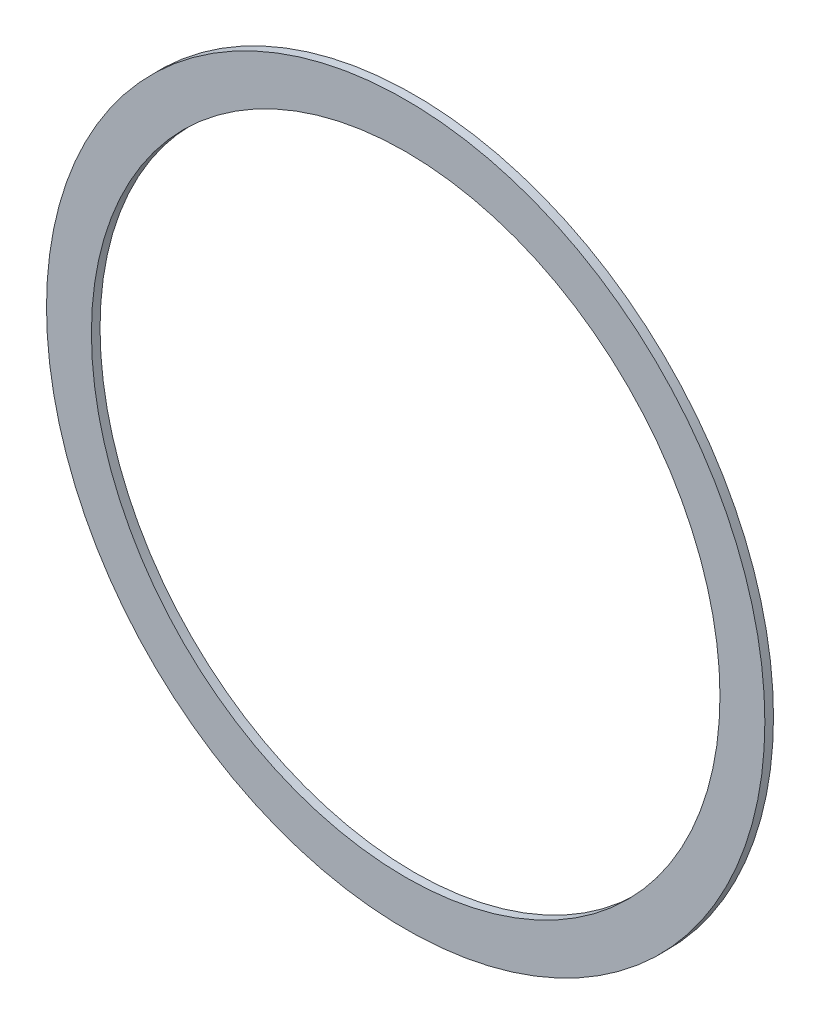
from build123d import *

# Parameters (mm, degrees)
SKETCH2_R           = 115.57
BOSS_EXTRUDE1_DEPTH = 1.5875


with BuildPart() as part:
    # Sketch2 → Boss-Extrude1 (new, symmetric)
    with BuildSketch(Plane.XY):
        with BuildLine():
            ThreePointArc((-1.651, 128.513680847), (-113.44208216, 64.09028885), (-116.977106193, -64.886930424))
            ThreePointArc((-116.977106193, -64.886930424), (-116.59127356, -65.61727077), (-116.200881143, -66.345183954))
            ThreePointArc((-116.200881143, -66.345183954), (-115.806084025, -67.070386581), (-115.406761019, -67.793106963))
            ThreePointArc((-115.406761019, -67.793106963), (0, -135.636), (115.406761019, -67.793106963))
            ThreePointArc((115.406761019, -67.793106963), (115.804512811, -67.073251299), (116.197774523, -66.350932884))
            ThreePointArc((116.197774523, -66.350932884), (116.589738292, -65.620154913), (116.977106193, -64.886930424))
            ThreePointArc((116.977106193, -64.886930424), (113.44208216, 64.09028885), (1.651, 128.513680847))
            ThreePointArc((1.651, 128.513680847), (0.825516124, 128.521420187), (0, 128.524))
            ThreePointArc((0, 128.524), (-0.825516124, 128.521420187), (-1.651, 128.513680847))
        make_face()
        with Locations((0, -3.556)):
            Circle(SKETCH2_R, mode=Mode.SUBTRACT)
    extrude(amount=BOSS_EXTRUDE1_DEPTH, both=True)


solid = part.part
